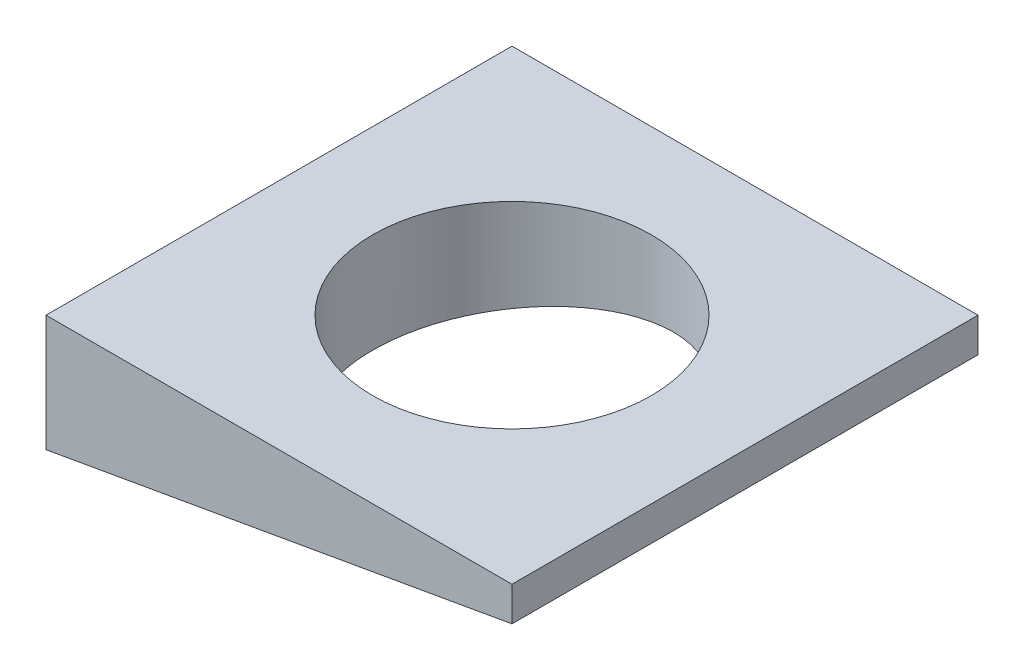
from build123d import *

# Parameters (mm, degrees)
SKETCH1_W             = 6.35
SKETCH1_H             = 6.35
BOSS_EXTRUDE1_DEPTH   = 1.5875
CUT_EXTRUDE1_DEPTH    = 8.274838916
F_6_CLEARANCE_HOLE1_D = 3.7973


with BuildPart() as part:
    # Sketch1 → Boss-Extrude1 (new body)
    with BuildSketch(Plane(origin=(0, 0, 0), x_dir=(1, 0, 0), z_dir=(0, 1, 0))):
        Rectangle(SKETCH1_W, SKETCH1_H)
    extrude(amount=BOSS_EXTRUDE1_DEPTH)

    # Sketch2 → Cut-Extrude1 (cut, through all)
    with BuildSketch(Plane.XY.offset(3.175)):
        Polygon((-3.175, 0), (3.175, 1.119676327), (3.175, 0), align=None)
    extrude(amount=-CUT_EXTRUDE1_DEPTH, mode=Mode.SUBTRACT)

    # #6 Clearance Hole1 (through all)
    with Locations(Plane(origin=(0, 1.5875, 0), x_dir=(1, 0, 0), z_dir=(0, 1, 0))):
        with Locations((0, 0)):
            Hole(F_6_CLEARANCE_HOLE1_D / 2)


solid = part.part
